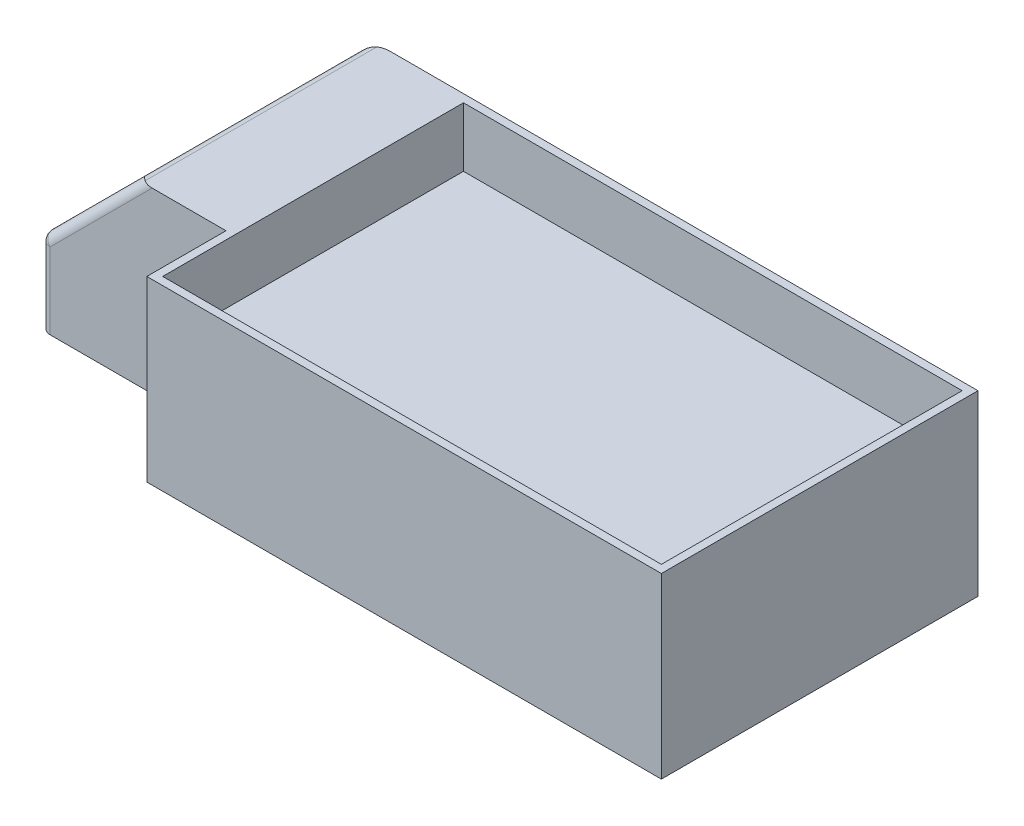
from build123d import *

# Parameters (mm, degrees)
SKETCH1_W           = 130
SKETCH1_H           = 80
BOSS_EXTRUDE1_DEPTH = 45
BOSS_EXTRUDE3_DEPTH = 80
CUT_EXTRUDE1_DEPTH  = 20
FILLET2_R           = 2.5
SHELL2_START        = -76
SHELL2_OUTLINE_W    = 122
SHELL2_OUTLINE_H    = 41
SHELL2_DEPTH        = 72
SHELL2_2_DEPTH      = 52
SKETCH9_W           = 130
SKETCH9_H           = 80
BOSS_EXTRUDE7_DEPTH = 20
SKETCH9_3_W         = 126
SKETCH9_3_H         = 76
CUT_EXTRUDE3_DEPTH  = 15
SKETCH10_W          = 25
SKETCH10_H          = 15
CUT_EXTRUDE4_DEPTH  = 15


# Read off the part's stored shape, not the designer's step: Shell2
with BuildPart() as part:
    # Sketch1 → Boss-Extrude1 (new body)
    with BuildSketch(Plane(origin=(0, 0, 0), x_dir=(1, 0, 0), z_dir=(0, 1, 0))):
        with Locations((65, 40)):
            Rectangle(SKETCH1_W, SKETCH1_H)
    extrude(amount=BOSS_EXTRUDE1_DEPTH)

    # Sketch3 → Boss-Extrude3 (add)
    with BuildSketch(Plane.XY):
        Polygon((0, 0), (0, 45), (-22.202683057, 45), (-46.951420398, 20.251262658), (-46.951420398, 0), align=None)
    extrude(amount=-BOSS_EXTRUDE3_DEPTH)

    # Sketch3<4> → Cut-Extrude1 (cut)
    with BuildSketch(Plane.XY):
        Polygon((0, 0), (0, 45), (-22.202683057, 45), (-46.951420398, 20.251262658), (-46.951420398, 0), align=None)
    extrude(amount=-CUT_EXTRUDE1_DEPTH, mode=Mode.SUBTRACT)

    # Fillet2
    fillet2_edges = [part.edges().sort_by_distance(p)[0] for p in [
        (-34.577051727, 32.625631329, -80),
        (-22.202683057, 45, -50),
        (-46.951420398, 20.251262658, -50),
        (-46.951420398, 10.125631329, -80),
        (-46.951420398, 10.125631329, -20),
        (-34.577051727, 32.625631329, -20),
    ]]
    fillet(fillet2_edges, radius=FILLET2_R)

    # Shell2 outline → Shell2 (cut)
    with BuildSketch(Plane.XY.offset(SHELL2_START)):
        with Locations((65, 20.5)):
            Rectangle(SHELL2_OUTLINE_W, SHELL2_OUTLINE_H)
    extrude(amount=SHELL2_DEPTH, mode=Mode.SUBTRACT)

    # Shell2 2 outline → Shell2 2 (cut)
    with BuildSketch(Plane.XY.offset(SHELL2_START)):
        Polygon((-20.545828807, 41), (-42.951420398, 18.594408409), (-42.951420398, 0), (4, 0), (4, 41), align=None)
    extrude(amount=SHELL2_2_DEPTH, mode=Mode.SUBTRACT)

    # Sketch9 → Boss-Extrude7 (add)
    with BuildSketch(Plane(origin=(0, 45, 0), x_dir=(1, 0, 0), z_dir=(0, 1, 0))):
        with Locations((65, 40)):
            Rectangle(SKETCH9_W, SKETCH9_H)
    extrude(amount=-BOSS_EXTRUDE7_DEPTH)

    # Sketch9<3> → Cut-Extrude3 (cut)
    with BuildSketch(Plane(origin=(0, 45, 0), x_dir=(1, 0, 0), z_dir=(0, 1, 0))):
        with Locations((65, 40)):
            Rectangle(SKETCH9_3_W, SKETCH9_3_H)
    extrude(amount=-CUT_EXTRUDE3_DEPTH, mode=Mode.SUBTRACT)

    # Sketch10 → Cut-Extrude4 (cut)
    with BuildSketch(Plane(origin=(-33.601341528, 33.601341528, 0), x_dir=(0, 0, 1), z_dir=(-0.7071067811865477, 0.7071067811865475, 0))):
        with Locations((-50, -1.379862597)):
            Rectangle(SKETCH10_W, SKETCH10_H)
    extrude(amount=-CUT_EXTRUDE4_DEPTH, mode=Mode.SUBTRACT)


solid = part.part
